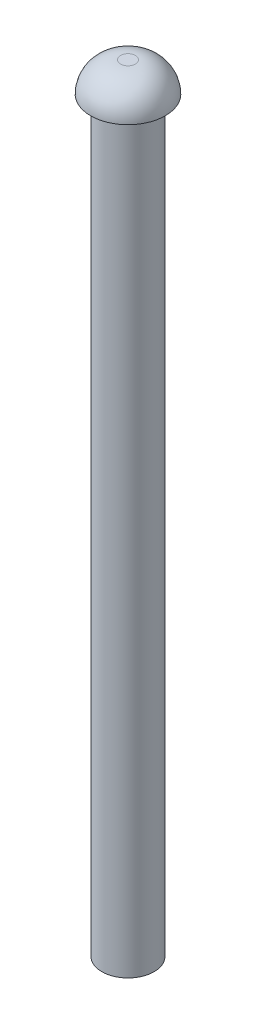
from build123d import *

# Parameters (mm, degrees)
SKETCH1_R           = 3.5
BOSS_EXTRUDE1_DEPTH = 100
SKETCH2_R           = 5
BOSS_EXTRUDE2_DEPTH = 4
FILLET3_R           = 4


with BuildPart() as part:
    # Sketch1 → Boss-Extrude1 (new body)
    with BuildSketch(Plane(origin=(0, 0, 0), x_dir=(1, 0, 0), z_dir=(0, 1, 0))):
        with Locations(Location((0, 0, 0), (0, 0, 270))):
            Circle(SKETCH1_R)
    extrude(amount=-BOSS_EXTRUDE1_DEPTH)

    # Sketch2 → Boss-Extrude2 (add)
    with BuildSketch(Plane(origin=(0, 0, 0), x_dir=(1, 0, 0), z_dir=(0, 1, 0))):
        with Locations(Location((0, 0, 0), (0, 0, 270))):
            Circle(SKETCH2_R)
    extrude(amount=BOSS_EXTRUDE2_DEPTH)

    # Fillet3
    fillet3_edges = [part.edges().sort_by_distance(p)[0] for p in [
        (0, 4, -5),
    ]]
    fillet(fillet3_edges, radius=FILLET3_R - 0.0001)  # a hair under: the kernel refuses the full size


solid = part.part
